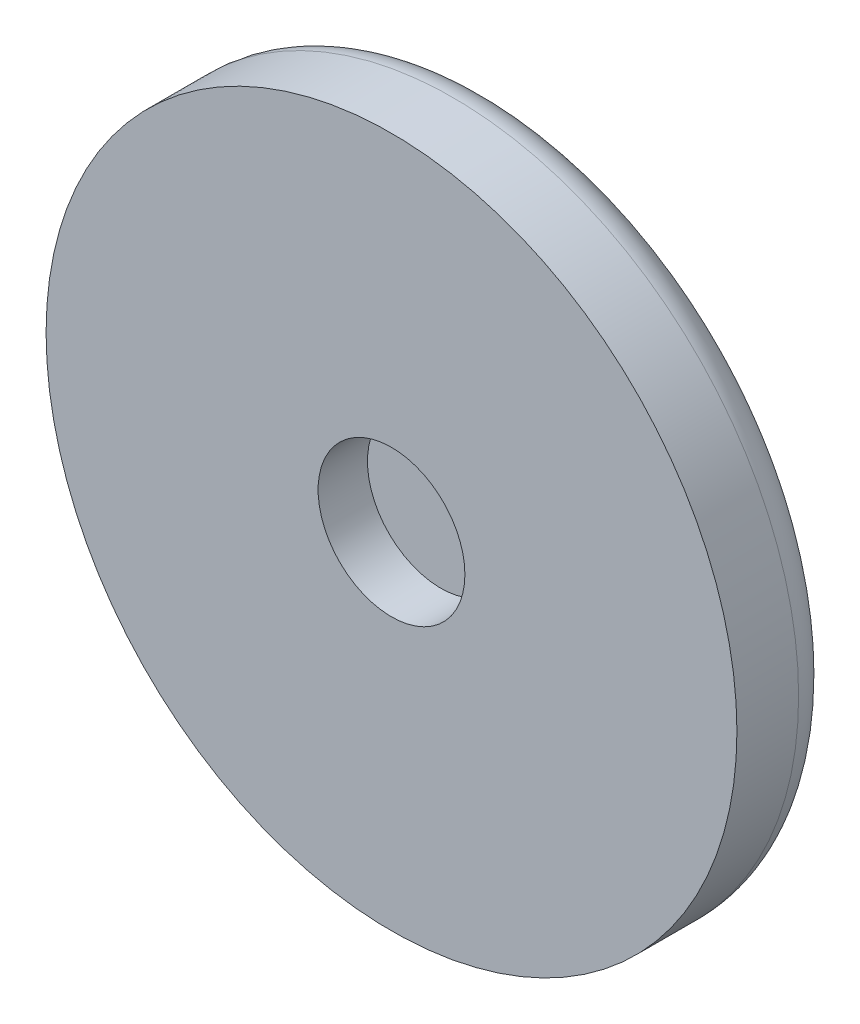
from build123d import *

# Parameters (mm, degrees)
SKETCH1_R           = 14
BOSS_EXTRUDE1_DEPTH = 4
SKETCH2_R           = 2.975
CUT_EXTRUDE1_DEPTH  = 2
SKETCH3_R           = 11
CUT_EXTRUDE2_DEPTH  = 1
FILLET1_R           = 0.5
FILLET2_R           = 1.5


with BuildPart() as part:
    # Sketch1 → Boss-Extrude1 (new body)
    with BuildSketch(Plane.XY):
        Circle(SKETCH1_R)
    extrude(amount=BOSS_EXTRUDE1_DEPTH)

    # Sketch2 → Cut-Extrude1 (cut)
    with BuildSketch(Plane.XY.offset(4)):
        Circle(SKETCH2_R)
    extrude(amount=-CUT_EXTRUDE1_DEPTH, mode=Mode.SUBTRACT)

    # Sketch3 → Cut-Extrude2 (cut)
    with BuildSketch(Plane(origin=(0, 0, 0), x_dir=(-1, 0, 0), z_dir=(0, 0, -1))):
        Circle(SKETCH3_R)
    extrude(amount=-CUT_EXTRUDE2_DEPTH, mode=Mode.SUBTRACT)

    # Fillet1
    fillet1_edges = [part.edges().sort_by_distance(p)[0] for p in [
        (11, 0, 1),
        (11, 0, 0),
    ]]
    fillet(fillet1_edges, radius=FILLET1_R - 0.0001)  # a hair under: the kernel refuses the full size

    # Fillet2
    fillet2_edges = [part.edges().sort_by_distance(p)[0] for p in [
        (-14, 0, 0),
    ]]
    fillet(fillet2_edges, radius=FILLET2_R)


solid = part.part
